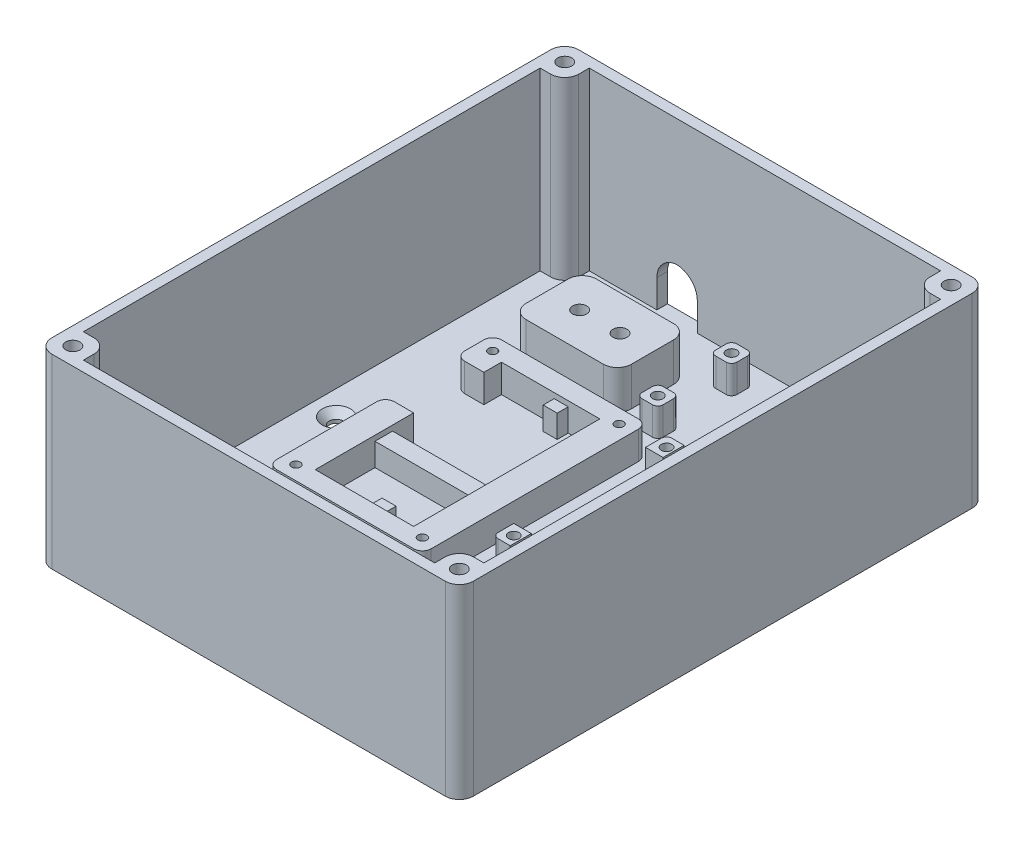
from build123d import *

# Parameters (mm, degrees)
CROQUIS1_W              = 120
CROQUIS1_H              = 150
CROQUIS1_R              = 2
SALIENTE_EXTRUIR1_DEPTH = 3
CROQUIS5_W              = 30
CROQUIS5_H              = 20
CROQUIS5_R              = 2
SALIENTE_EXTRUIR2_DEPTH = 11
CROQUIS7_W              = 20
CROQUIS7_H              = 30
CROQUIS7_R              = 2
SALIENTE_EXTRUIR3_DEPTH = 11
CROQUIS3_W              = 6
CROQUIS3_H              = 6
CROQUIS3_R              = 1.5
SALIENTE_EXTRUIR4_DEPTH = 8
CROQUIS2_W              = 5
CROQUIS2_H              = 6
CROQUIS2_R              = 1.5
SALIENTE_EXTRUIR5_DEPTH = 8
CROQUIS4_W              = 44
CROQUIS4_H              = 64
CROQUIS4_R              = 1.25
SALIENTE_EXTRUIR6_DEPTH = 8
CROQUIS8_W              = 28
CROQUIS8_H              = 53
CORTAR_EXTRUIR1_DEPTH   = 1.5
CORTAR_EXTRUIR2_DEPTH   = 6.5
CROQUIS10_W             = 8
CROQUIS10_H             = 20
CORTAR_EXTRUIR3_DEPTH   = 8
REDONDEO3_R             = 4
REDONDEO4_R             = 2.5
REDONDEO5_R             = 1.5
CROQUIS11_W             = 120
CROQUIS11_H             = 150
SALIENTE_EXTRUIR7_DEPTH = 50
CROQUIS12_R             = 2
CORTAR_EXTRUIR4_DEPTH   = 15
CHAFL_N1_SIZE           = 2
REDONDEO6_R             = 4
REDONDEO7_R             = 4
CROQUIS13_W             = 11.5
CROQUIS13_H             = 14
CORTAR_EXTRUIR5_DEPTH   = 149.738024728
REDONDEO8_R             = 6
CROQUIS16_W             = 11.5
CROQUIS16_H             = 14
CORTAR_EXTRUIR6_DEPTH   = 168.385781953
REDONDEO9_R             = 6


with BuildPart() as part:
    # Croquis1 → Saliente-Extruir1 (new body)
    with BuildSketch(Plane(origin=(0, 0, 0), x_dir=(1, 0, 0), z_dir=(0, 1, 0))):
        Rectangle(CROQUIS1_W, CROQUIS1_H)
        with Locations(Location((-50, 0, 0), (0, 0, 270))):
            Circle(CROQUIS1_R, mode=Mode.SUBTRACT)
        with Locations(Location((50, 0, 0), (0, 0, 270))):
            Circle(CROQUIS1_R, mode=Mode.SUBTRACT)
    extrude(amount=SALIENTE_EXTRUIR1_DEPTH)

    # Croquis5 → Saliente-Extruir2 (add)
    with BuildSketch(Plane(origin=(0, 3, 0), x_dir=(1, 0, 0), z_dir=(0, 1, 0))):
        with Locations((-25, 50)):
            Rectangle(CROQUIS5_W, CROQUIS5_H)
        with Locations(Location((-30.75, 50, 0), (0, 0, 270))):
            Circle(CROQUIS5_R, mode=Mode.SUBTRACT)
        with Locations(Location((-19.25, 50, 0), (0, 0, 270))):
            Circle(CROQUIS5_R, mode=Mode.SUBTRACT)
    extrude(amount=SALIENTE_EXTRUIR2_DEPTH)

    # Croquis7 → Saliente-Extruir3 (add)
    with BuildSketch(Plane(origin=(0, 3, 0), x_dir=(1, 0, 0), z_dir=(0, 1, 0))):
        with Locations((-20, -50)):
            Rectangle(CROQUIS7_W, CROQUIS7_H)
        with Locations(Location((-20, -44.25, 0), (0, 0, 270))):
            Circle(CROQUIS7_R, mode=Mode.SUBTRACT)
        with Locations(Location((-20, -55.75, 0), (0, 0, 270))):
            Circle(CROQUIS7_R, mode=Mode.SUBTRACT)
    extrude(amount=SALIENTE_EXTRUIR3_DEPTH)

    # Croquis3 → Saliente-Extruir4 (add)
    # profile 1 of 4: a face of its own
    with BuildSketch(Plane(origin=(0, 3, 0), x_dir=(1, 0, 0), z_dir=(0, 1, 0))):
        with Locations((-1.5, 64)):
            Rectangle(CROQUIS3_W, CROQUIS3_H)
        with Locations(Location((-1.5, 64, 0), (0, 0, 270))):
            Circle(CROQUIS3_R, mode=Mode.SUBTRACT)
    # profile 2 of 4: a face of its own
    with BuildSketch(Plane(origin=(0, 3, 0), x_dir=(1, 0, 0), z_dir=(0, 1, 0))):
        with Locations((27.5, 64)):
            Rectangle(CROQUIS3_W, CROQUIS3_H)
        with Locations(Location((27.5, 64, 0), (0, 0, 270))):
            Circle(CROQUIS3_R, mode=Mode.SUBTRACT)
    # profile 3 of 4: a face of its own
    with BuildSketch(Plane(origin=(0, 3, 0), x_dir=(1, 0, 0), z_dir=(0, 1, 0))):
        with Locations((27.5, 43)):
            Rectangle(CROQUIS3_W, CROQUIS3_H)
        with Locations(Location((27.5, 43, 0), (0, 0, 270))):
            Circle(CROQUIS3_R, mode=Mode.SUBTRACT)
    # profile 4 of 4: a face of its own
    with BuildSketch(Plane(origin=(0, 3, 0), x_dir=(1, 0, 0), z_dir=(0, 1, 0))):
        with Locations((-1.5, 43)):
            Rectangle(CROQUIS3_W, CROQUIS3_H)
        with Locations(Location((-1.5, 43, 0), (0, 0, 270))):
            Circle(CROQUIS3_R, mode=Mode.SUBTRACT)
    extrude(amount=SALIENTE_EXTRUIR4_DEPTH)

    # Croquis2 → Saliente-Extruir5 (add)
    # profile 1 of 4: a face of its own
    with BuildSketch(Plane(origin=(0, 3, 0), x_dir=(1, 0, 0), z_dir=(0, 1, 0))):
        with Locations((12, 31.5)):
            Rectangle(CROQUIS2_W, CROQUIS2_H)
        with Locations(Location((12.5, 31.5, 0), (0, 0, 270))):
            Circle(CROQUIS2_R, mode=Mode.SUBTRACT)
    # profile 2 of 4: a face of its own
    with BuildSketch(Plane(origin=(0, 3, 0), x_dir=(1, 0, 0), z_dir=(0, 1, 0))):
        with Locations((34, 31.5)):
            Rectangle(CROQUIS2_W, CROQUIS2_H)
        with Locations(Location((33.5, 31.5, 0), (0, 0, 270))):
            Circle(CROQUIS2_R, mode=Mode.SUBTRACT)
    # profile 3 of 4: a face of its own
    with BuildSketch(Plane(origin=(0, 3, 0), x_dir=(1, 0, 0), z_dir=(0, 1, 0))):
        with Locations((34, -12)):
            Rectangle(CROQUIS2_W, CROQUIS2_H)
        with Locations(Location((33.5, -12, 0), (0, 0, 270))):
            Circle(CROQUIS2_R, mode=Mode.SUBTRACT)
    # profile 4 of 4: a face of its own
    with BuildSketch(Plane(origin=(0, 3, 0), x_dir=(1, 0, 0), z_dir=(0, 1, 0))):
        with Locations((12, -12)):
            Rectangle(CROQUIS2_W, CROQUIS2_H)
        with Locations(Location((12.5, -12, 0), (0, 0, 270))):
            Circle(CROQUIS2_R, mode=Mode.SUBTRACT)
    extrude(amount=SALIENTE_EXTRUIR5_DEPTH)

    # Croquis4 → Saliente-Extruir6 (add)
    with BuildSketch(Plane(origin=(0, 3, 0), x_dir=(1, 0, 0), z_dir=(0, 1, 0))):
        with Locations((-18, 2.5)):
            Rectangle(CROQUIS4_W, CROQUIS4_H)
        with Locations(Location((-36, 30.5, 0), (0, 0, 270))):
            Circle(CROQUIS4_R, mode=Mode.SUBTRACT)
        with Locations(Location((0, 30.5, 0), (0, 0, 270))):
            Circle(CROQUIS4_R, mode=Mode.SUBTRACT)
        with Locations(Location((0, -25.5, 0), (0, 0, 270))):
            Circle(CROQUIS4_R, mode=Mode.SUBTRACT)
        with Locations(Location((-36, -25.5, 0), (0, 0, 270))):
            Circle(CROQUIS4_R, mode=Mode.SUBTRACT)
    extrude(amount=SALIENTE_EXTRUIR6_DEPTH)

    # Croquis8 → Cortar-Extruir1 (cut)
    with BuildSketch(Plane(origin=(0, 11, 0), x_dir=(1, 0, 0), z_dir=(0, 1, 0))):
        with Locations((-18, 2.5)):
            Rectangle(CROQUIS8_W, CROQUIS8_H)
    extrude(amount=-CORTAR_EXTRUIR1_DEPTH, mode=Mode.SUBTRACT)

    # Croquis9 → Cortar-Extruir2 (cut)
    with BuildSketch(Plane(origin=(0, 9.5, 0), x_dir=(1, 0, 0), z_dir=(0, 1, 0))):
        Polygon((-32, 29), (-17, 29), (-17, 25.861790145), (-13, 25.861790145), (-13, 29), (-4, 29), (-4, -2), (-32, -2), align=None)
        Polygon((-32, -24), (-17, -24), (-17, -20), (-13, -20), (-13, -24), (-4, -24), (-4, -7), (-32, -7), align=None)
    extrude(amount=-CORTAR_EXTRUIR2_DEPTH, mode=Mode.SUBTRACT)

    # Croquis10 → Cortar-Extruir3 (cut)
    with BuildSketch(Plane(origin=(0, 11, 0), x_dir=(1, 0, 0), z_dir=(0, 1, 0))):
        with Locations((-36, 14)):
            Rectangle(CROQUIS10_W, CROQUIS10_H)
    extrude(amount=-CORTAR_EXTRUIR3_DEPTH, mode=Mode.SUBTRACT)

    # Redondeo3
    redondeo3_edges = [part.edges().sort_by_distance(p)[0] for p in [
        (-10, 8.5, -40),
        (-10, 8.5, -60),
        (-40, 8.5, -60),
        (-40, 8.5, -40),
        (-10, 8.5, 65),
        (-10, 8.5, 35),
        (-30, 8.5, 35),
        (-30, 8.5, 65),
    ]]
    fillet(redondeo3_edges, radius=REDONDEO3_R)

    # Redondeo4
    redondeo4_edges = [part.edges().sort_by_distance(p)[0] for p in [
        (4, 7, 29.5),
        (4, 7, -34.5),
        (-40, 7, -34.5),
        (-40, 7, 29.5),
        (-40, 7, -4),
        (-40, 7, -24),
    ]]
    fillet(redondeo4_edges, radius=REDONDEO4_R)

    # Redondeo5
    redondeo5_edges = [part.edges().sort_by_distance(p)[0] for p in [
        (30.5, 7, -40),
        (30.5, 7, -46),
        (24.5, 7, -46),
        (24.5, 7, -40),
        (36.5, 7, -34.5),
        (9.5, 7, 15),
        (9.5, 7, -34.5),
        (36.5, 7, 15),
        (30.5, 7, -61),
        (30.5, 7, -67),
        (24.5, 7, -67),
        (24.5, 7, -61),
        (-4.5, 7, -46),
        (-4.5, 7, -40),
        (1.5, 7, -40),
        (1.5, 7, -46),
        (-4.5, 7, -67),
        (-4.5, 7, -61),
        (1.5, 7, -61),
        (1.5, 7, -67),
    ]]
    fillet(redondeo5_edges, radius=REDONDEO5_R)

    # Croquis11 → Saliente-Extruir7 (add)
    with BuildSketch(Plane(origin=(0, 3, 0), x_dir=(1, 0, 0), z_dir=(0, 1, 0))):
        Rectangle(CROQUIS11_W, CROQUIS11_H)
        Polygon((-50, 72), (-50, 65), (-57, 65), (-57, -65), (-50, -65), (-50, -72), (50, -72), (50, -65), (57, -65), (57, 65), (50, 65), (50, 72), align=None, mode=Mode.SUBTRACT)
    extrude(amount=SALIENTE_EXTRUIR7_DEPTH)

    # Croquis12 → Cortar-Extruir4 (cut)
    with BuildSketch(Plane(origin=(0, 53, 0), x_dir=(1, 0, 0), z_dir=(0, 1, 0))):
        with Locations(Location((-55, 70, 0), (0, 0, 270))):
            Circle(CROQUIS12_R)
        with Locations(Location((55, 70, 0), (0, 0, 270))):
            Circle(CROQUIS12_R)
        with Locations(Location((-55, -70, 0), (0, 0, 270))):
            Circle(CROQUIS12_R)
        with Locations(Location((55, -70, 0), (0, 0, 270))):
            Circle(CROQUIS12_R)
    extrude(amount=-CORTAR_EXTRUIR4_DEPTH, mode=Mode.SUBTRACT)

    # Chaflán1
    chafl_n1_edges = [part.edges().sort_by_distance(p)[0] for p in [
        (-50, 3, -2),
        (50, 3, -2),
    ]]
    chamfer(chafl_n1_edges, length=CHAFL_N1_SIZE)

    # Redondeo6
    redondeo6_edges = [part.edges().sort_by_distance(p)[0] for p in [
        (60, 26.5, 75),
        (-60, 26.5, 75),
        (-60, 26.5, -75),
        (60, 26.5, -75),
    ]]
    fillet(redondeo6_edges, radius=REDONDEO6_R)

    # Redondeo7
    redondeo7_edges = [part.edges().sort_by_distance(p)[0] for p in [
        (-50, 28, -65),
        (-50, 28, 65),
        (50, 28, 65),
        (50, 28, -65),
    ]]
    fillet(redondeo7_edges, radius=REDONDEO7_R)

    # Croquis13 → Cortar-Extruir5 (cut, through all)
    with BuildSketch(Plane(origin=(-57, 0, 0), x_dir=(0, 0, -1), z_dir=(1, 0, 0))):
        with Locations((-50, 10)):
            Rectangle(CROQUIS13_W, CROQUIS13_H)
    extrude(amount=-CORTAR_EXTRUIR5_DEPTH, mode=Mode.SUBTRACT)

    # Redondeo8
    # the kernel refuses this fillet: 6 mm, written as the material it adds along each edge
    with BuildSketch(Plane(origin=(-57, 17, 55.75), x_dir=(0, 0, -1), z_dir=(-1, 0, 0)), Plane(origin=(-57, 17, 44.25), x_dir=(0, -1, 0), z_dir=(-1, 0, 0))) as redondeo8_piece_1:
        with BuildLine():
            CenterArc((REDONDEO8_R, REDONDEO8_R), REDONDEO8_R, 180, 90)
            Line((0, REDONDEO8_R), (0, 0))
            Line((0, 0), (REDONDEO8_R, 0))
        make_face()
    extrude(amount=3)

    # Croquis16 → Cortar-Extruir6 (cut, through all)
    with BuildSketch(Plane.XY.offset(-72)):
        with Locations((-25, 10)):
            Rectangle(CROQUIS16_W, CROQUIS16_H)
    extrude(amount=-CORTAR_EXTRUIR6_DEPTH, mode=Mode.SUBTRACT)

    # Redondeo9
    # the kernel refuses this fillet: 6 mm, written as the material it adds along each edge
    with BuildSketch(Plane(origin=(-30.75, 17, -72), x_dir=(1, 0, 0), z_dir=(0, 0, -1)), Plane(origin=(-19.25, 17, -72), x_dir=(0, -1, 0), z_dir=(0, 0, -1))) as redondeo9_piece_1:
        with BuildLine():
            CenterArc((REDONDEO9_R, REDONDEO9_R), REDONDEO9_R, 180, 90)
            Line((0, REDONDEO9_R), (0, 0))
            Line((0, 0), (REDONDEO9_R, 0))
        make_face()
    extrude(amount=3)


solid = part.part
